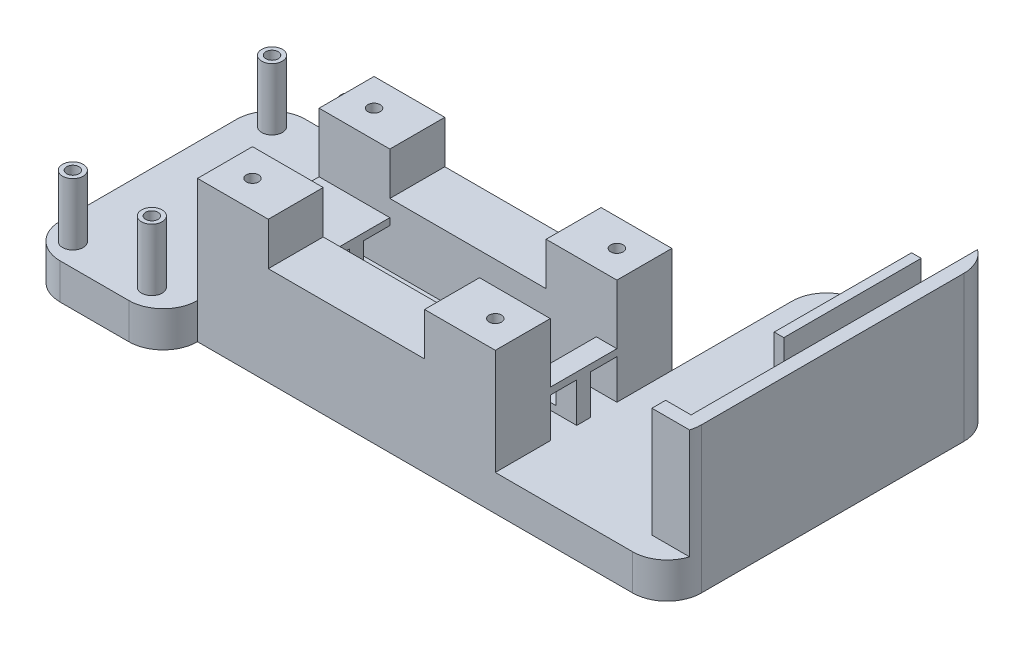
from build123d import *

# Parameters (mm, degrees)
EXTRUDE_1_DEPTH     = 16
F_1_0MM_1_D         = 3.6
F_1_0MM_2_D         = 3.6
SKETCH_8_W          = 86.7
SKETCH_8_H          = 16
EXTRUDE_2_DEPTH     = 21.2
SKETCH_9_W          = 86.7
SKETCH_9_H          = 10.4
EXTRUDE_3_DEPTH     = 9.7
SKETCH_15_W         = 20.6
SKETCH_15_H         = 2
EXTRUDE_8_DEPTH     = 13.5
SKETCH_16_W         = 20.6
SKETCH_16_H         = 2
EXTRUDE_9_DEPTH     = 10.5
SKETCH_19_W         = 51.4
SKETCH_19_H         = 10.4
EXTRUDE_10_DEPTH    = 50
SKETCH_25_W         = 50
SKETCH_25_H         = 10.4
EXTRUDE_11_DEPTH    = 45
EXTRUDE_12_DEPTH    = 32
CUT_EXTRUDE_1_DEPTH = 5
SKETCH_29_W         = 51.4
SKETCH_29_H         = 10.402970243
EXTRUDE_13_DEPTH    = 40
SKETCH_32_W         = 40
SKETCH_32_H         = 10.402970243
EXTRUDE_14_DEPTH    = 10
SKETCH_33_W         = 40
SKETCH_33_H         = 10.402970243
EXTRUDE_15_DEPTH    = 10
SKETCH_34_R         = 3
EXTRUDE_16_DEPTH    = 18
F_1_0MM_3_D         = 3.6
F_1_0MM_4_D         = 3.6
FILLET_1_R          = 10
FILLET_2_R          = 10
SKETCH_40_W         = 6
SKETCH_40_H         = 4
EXTRUDE_17_DEPTH    = 11.5
SKETCH_42_W         = 6
SKETCH_42_H         = 19.4
EXTRUDE_18_DEPTH    = 2
SKETCH_46_W         = 60.1
SKETCH_46_H         = 4
EXTRUDE_19_DEPTH    = 2


with BuildPart() as part:
    # 草图1 → 凸台-拉伸1 (new body)
    with BuildSketch(Plane.XY):
        Polygon((-21.523113208, 25.59839861), (-42.123113208, 25.59839861), (-42.123113208, 5.59839861), (44.576886792, 5.59839861), (44.576886792, 25.59839861), (23.976886792, 25.59839861), (23.976886792, 13.12839861), (-21.523113208, 13.12839861), align=None)
    extrude_1 = extrude(amount=EXTRUDE_1_DEPTH)

    # Ø1.0mm 暗销孔1 (through all)
    with Locations(Plane(origin=(0, 25.59839861, 0), x_dir=(1, 0, 0), z_dir=(0, 1, 0))):
        with Locations((36.576886792, -8)):
            f_1_0mm_1 = Hole(F_1_0MM_1_D / 2)

    # Ø1.0mm 暗销孔2 (through all)
    with Locations(Plane(origin=(0, 25.59839861, 0), x_dir=(1, 0, 0), z_dir=(0, 1, 0))):
        with Locations((-34.123113208, -8)):
            f_1_0mm_2 = Hole(F_1_0MM_2_D / 2)

    # 草图8 → 凸台-拉伸2 (add)
    with BuildSketch(Plane.XZ.offset(-5.59839861)):
        with Locations((1.226886792, 8)):
            Rectangle(SKETCH_8_W, SKETCH_8_H)
    extrude_2 = extrude(amount=EXTRUDE_2_DEPTH)

    # 草图9 → 凸台-拉伸3 (add)
    with BuildSketch(Plane(origin=(0, 0, 0), x_dir=(-1, 0, 0), z_dir=(0, 0, -1))):
        with Locations((-1.226886792, -10.40160139)):
            Rectangle(SKETCH_9_W, SKETCH_9_H)
    extrude_3 = extrude(amount=EXTRUDE_3_DEPTH)

    # 草图15 → 凸台-拉伸8 (add)
    with BuildSketch(Plane(origin=(0, -5.20160139, 0), x_dir=(1, 0, 0), z_dir=(0, 1, 0))):
        with Locations((-31.823113208, 8.7)):
            Rectangle(SKETCH_15_W, SKETCH_15_H)
    extrude_8 = extrude(amount=EXTRUDE_8_DEPTH)

    # 草图16 → 凸台-拉伸9 (add)
    with BuildSketch(Plane(origin=(0, 0, -9.7), x_dir=(-1, 0, 0), z_dir=(0, 0, -1))):
        with Locations((31.823113208, 7.29839861)):
            Rectangle(SKETCH_16_W, SKETCH_16_H)
    extrude_9 = extrude(amount=-EXTRUDE_9_DEPTH)

    # 镜向20: 凸台-拉伸1, Ø1.0mm 暗销孔1, Ø1.0mm 暗销孔2, 凸台-拉伸2, 凸台-拉伸3, 凸台-拉伸8, 凸台-拉伸9 across plane
    add(extrude_1.mirror(Plane.XY.offset(-9.7)))
    add(f_1_0mm_1.mirror(Plane.XY.offset(-9.7)), mode=Mode.SUBTRACT)
    add(f_1_0mm_2.mirror(Plane.XY.offset(-9.7)), mode=Mode.SUBTRACT)
    add(extrude_2.mirror(Plane.XY.offset(-9.7)))
    add(extrude_3.mirror(Plane.XY.offset(-9.7)))
    add(extrude_8.mirror(Plane.XY.offset(-9.7)))
    add(extrude_9.mirror(Plane.XY.offset(-9.7)))

    # 草图19 → 凸台-拉伸10 (add)
    with BuildSketch(Plane(origin=(44.576886792, 0, 0), x_dir=(0, 0, -1), z_dir=(1, 0, 0))):
        with Locations((9.7, -10.40160139)):
            Rectangle(SKETCH_19_W, SKETCH_19_H)
    extrude(amount=EXTRUDE_10_DEPTH)

    # 草图25 → 凸台-拉伸11 (add)
    with BuildSketch(Plane(origin=(0, 0, -35.4), x_dir=(-1, 0, 0), z_dir=(0, 0, -1))):
        with Locations((-69.576886792, -10.40160139)):
            Rectangle(SKETCH_25_W, SKETCH_25_H)
    extrude(amount=EXTRUDE_11_DEPTH)

    # 草图26 → 凸台-拉伸12 (add)
    with BuildSketch(Plane(origin=(0, -5.20160139, 0), x_dir=(1, 0, 0), z_dir=(0, 1, 0))):
        Polygon((83.176886792, -9), (94.576886792, -9), (94.576886792, -5), (94.576886792, 80.4), (90.576886792, 80.4), (90.576886792, -5), (83.176886792, -5), align=None)
        Polygon((83.176886792, 28), (84.576886792, 28), (84.576886792, 68), (83.176886792, 68), (81.776886792, 68), (81.776886792, 28), align=None)
    extrude(amount=EXTRUDE_12_DEPTH)

    # 草图28 → 切除-拉伸1 (cut)
    with BuildSketch(Plane(origin=(0, -5.20160139, 0), x_dir=(1, 0, 0), z_dir=(0, 1, 0))):
        Polygon((90.576886792, -5), (84.576886792, -5), (82.576886792, -5), (82.576886792, 28), (84.576886792, 28), (84.576886792, 80.4), (90.576886792, 80.4), align=None)
    extrude(amount=-CUT_EXTRUDE_1_DEPTH, mode=Mode.SUBTRACT)

    # 草图29 → 凸台-拉伸13 (add)
    with BuildSketch(Plane.ZY.offset(42.123113208)):
        with Locations((-9.7, -10.400116268)):
            Rectangle(SKETCH_29_W, SKETCH_29_H)
    extrude(amount=EXTRUDE_13_DEPTH)

    # 草图32 → 凸台-拉伸14 (add)
    with BuildSketch(Plane(origin=(0, 0, -35.4), x_dir=(-1, 0, 0), z_dir=(0, 0, -1))):
        with Locations((62.123113208, -10.400116268)):
            Rectangle(SKETCH_32_W, SKETCH_32_H)
    extrude(amount=EXTRUDE_14_DEPTH)

    # 草图33 → 凸台-拉伸15 (add)
    with BuildSketch(Plane.XY.offset(16)):
        with Locations((-62.123113208, -10.400116268)):
            Rectangle(SKETCH_33_W, SKETCH_33_H)
    extrude(amount=EXTRUDE_15_DEPTH)

    # 草图34 → 凸台-拉伸16 (add)
    with BuildSketch(Plane(origin=(0, -5.198631147, 0), x_dir=(1, 0, 0), z_dir=(0, 1, 0))):
        with Locations(Location((-52.123113208, 38.7, 0), (0, 0, 90))):
            Circle(SKETCH_34_R)
        with Locations(Location((-75.123113208, 38.7, 0), (0, 0, 90))):
            Circle(SKETCH_34_R)
        with Locations(Location((-52.123113208, -19.3, 0), (0, 0, 90))):
            Circle(SKETCH_34_R)
        with Locations(Location((-75.123113208, -19.3, 0), (0, 0, 90))):
            Circle(SKETCH_34_R)
    extrude(amount=EXTRUDE_16_DEPTH)

    # Ø1.0mm 暗销孔3 (through all)
    with Locations(Plane(origin=(0, 12.801368853, 0), x_dir=(1, 0, 0), z_dir=(0, 1, 0))):
        with Locations((-52.123113208, 38.7)):
            Hole(F_1_0MM_3_D / 2)

    # Ø1.0mm 暗销孔4 (through all)
    with Locations(Plane(origin=(0, 12.801368853, 0), x_dir=(1, 0, 0), z_dir=(0, 1, 0))):
        with Locations((-52.123113208, -19.3), (-75.123113208, 38.7), (-75.123113208, -19.3)):
            Hole(F_1_0MM_4_D / 2)

    # 圆角1
    fillet_1_edges = [part.edges().sort_by_distance(p)[0] for p in [
        (44.576886792, -10.40160139, -80.4),
        (94.576886792, -10.40160139, 16),
        (-42.123113208, -10.400116268, -45.4),
        (-42.123113208, -10.400116268, 26),
        (-82.123113208, -10.400116268, -45.4),
        (-82.123113208, -10.400116268, 26),
    ]]
    fillet(fillet_1_edges, radius=FILLET_1_R - 0.0001)  # a hair under: the kernel refuses the full size

    # 圆角2
    fillet_2_edges = [part.edges().sort_by_distance(p)[0] for p in [
        (94.576886792, 5.59839861, -80.4),
    ]]
    fillet(fillet_2_edges, radius=FILLET_2_R - 0.0001)  # a hair under: the kernel refuses the full size

    # 草图40 → 凸台-拉伸17 (add)
    with BuildSketch(Plane(origin=(0, -5.20160139, 0), x_dir=(1, 0, 0), z_dir=(0, 1, 0))):
        with Locations((41.576886792, 9.7)):
            Rectangle(SKETCH_40_W, SKETCH_40_H)
    extrude(amount=EXTRUDE_17_DEPTH)

    # 草图42 → 凸台-拉伸18 (add)
    with BuildSketch(Plane(origin=(0, 6.29839861, 0), x_dir=(1, 0, 0), z_dir=(0, 1, 0))):
        with Locations((41.576886792, 9.7)):
            Rectangle(SKETCH_42_W, SKETCH_42_H)
    extrude(amount=EXTRUDE_18_DEPTH)

    # 草图46 → 凸台-拉伸19 (add)
    with BuildSketch(Plane(origin=(0, -5.20160139, 0), x_dir=(1, 0, 0), z_dir=(0, 1, 0))):
        with Locations((8.526886792, 9.7)):
            Rectangle(SKETCH_46_W, SKETCH_46_H)
    extrude(amount=EXTRUDE_19_DEPTH)


solid = part.part
